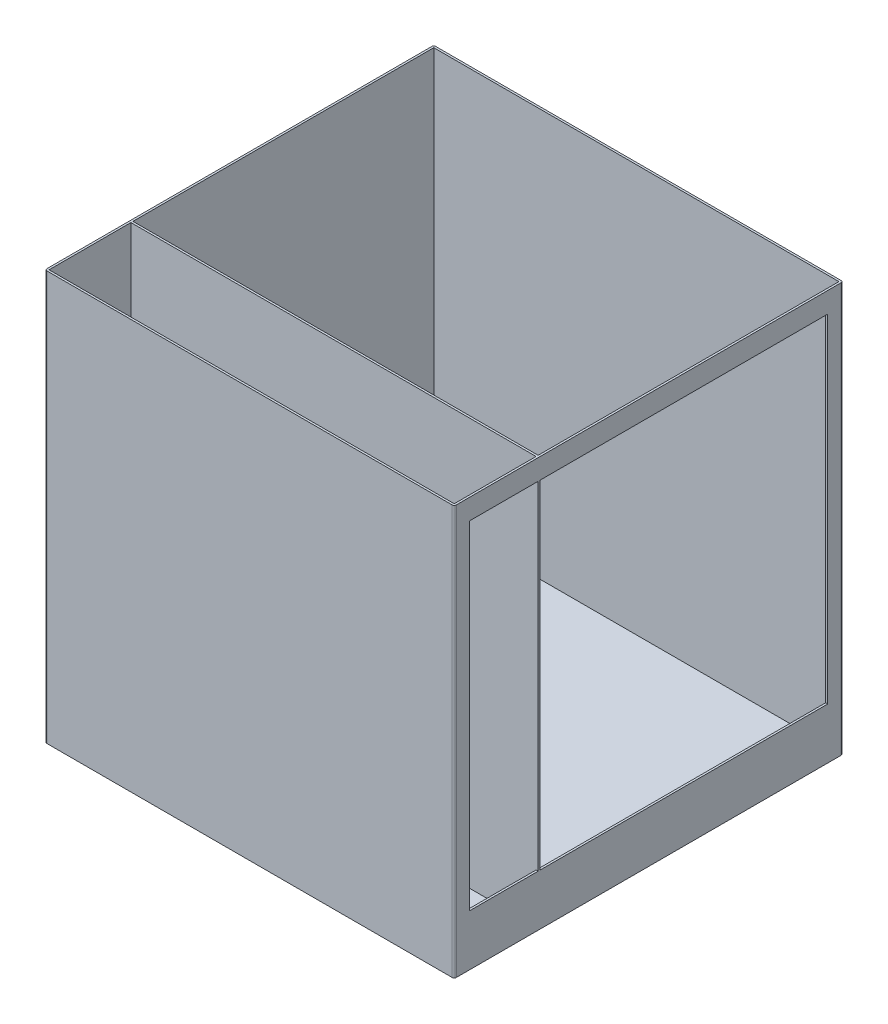
from build123d import *

# Parameters (mm, degrees)
SKETCH1_W           = 400
SKETCH1_H           = 380
BOSS_EXTRUDE1_DEPTH = 200
FILLET1_R           = 2
SHELL1_START        = -198
SHELL1_OUTLINE_W    = 398
SHELL1_OUTLINE_H    = 376
SHELL1_DEPTH        = 396
SKETCH2_W           = 350
SKETCH2_H           = 330
CUT_EXTRUDE1_DEPTH  = 485.256130576
BOSS_EXTRUDE2_REACH = 487.901
SKETCH3_W           = 400
SKETCH3_H           = 2


# Read off the part's stored shape, not the designer's step: Shell1
with BuildPart() as part:
    # Sketch1 → Boss-Extrude1 (new, symmetric)
    with BuildSketch(Plane(origin=(0, 0, 0), x_dir=(1, 0, 0), z_dir=(0, 1, 0))):
        Rectangle(SKETCH1_W, SKETCH1_H)
    extrude(amount=BOSS_EXTRUDE1_DEPTH, both=True)

    # Fillet1
    fillet1_edges = [part.edges().sort_by_distance(p)[0] for p in [
        (200, 0, 190),
        (-200, 0, 190),
        (-200, 0, -190),
        (200, 0, -190),
    ]]
    fillet(fillet1_edges, radius=FILLET1_R)

    # Shell1 outline → Shell1 (cut)
    with BuildSketch(Plane.YZ.offset(SHELL1_START)):
        with Locations((1, 0)):
            Rectangle(SHELL1_OUTLINE_W, SHELL1_OUTLINE_H)
    extrude(amount=SHELL1_DEPTH, mode=Mode.SUBTRACT)

    # Sketch2 → Cut-Extrude1 (cut, through all)
    with BuildSketch(Plane.ZY.offset(-198)):
        with Locations((0, 15)):
            Rectangle(SKETCH2_W, SKETCH2_H)
    extrude(amount=-CUT_EXTRUDE1_DEPTH, mode=Mode.SUBTRACT)

    # Sketch3 → Boss-Extrude2 (add, up to next)
    with BuildSketch(Plane(origin=(0, 200, 0), x_dir=(1, 0, 0), z_dir=(0, 1, 0)), mode=Mode.PRIVATE) as boss_extrude2_sk1:
        with Locations((0, -107)):
            Rectangle(SKETCH3_W, SKETCH3_H)
    boss_extrude2_tool1 = extrude(boss_extrude2_sk1.sketch, amount=-BOSS_EXTRUDE2_REACH, mode=Mode.PRIVATE) - part.part
    add(boss_extrude2_tool1.solids().sort_by_distance((0, 200, 107))[0])


solid = part.part
